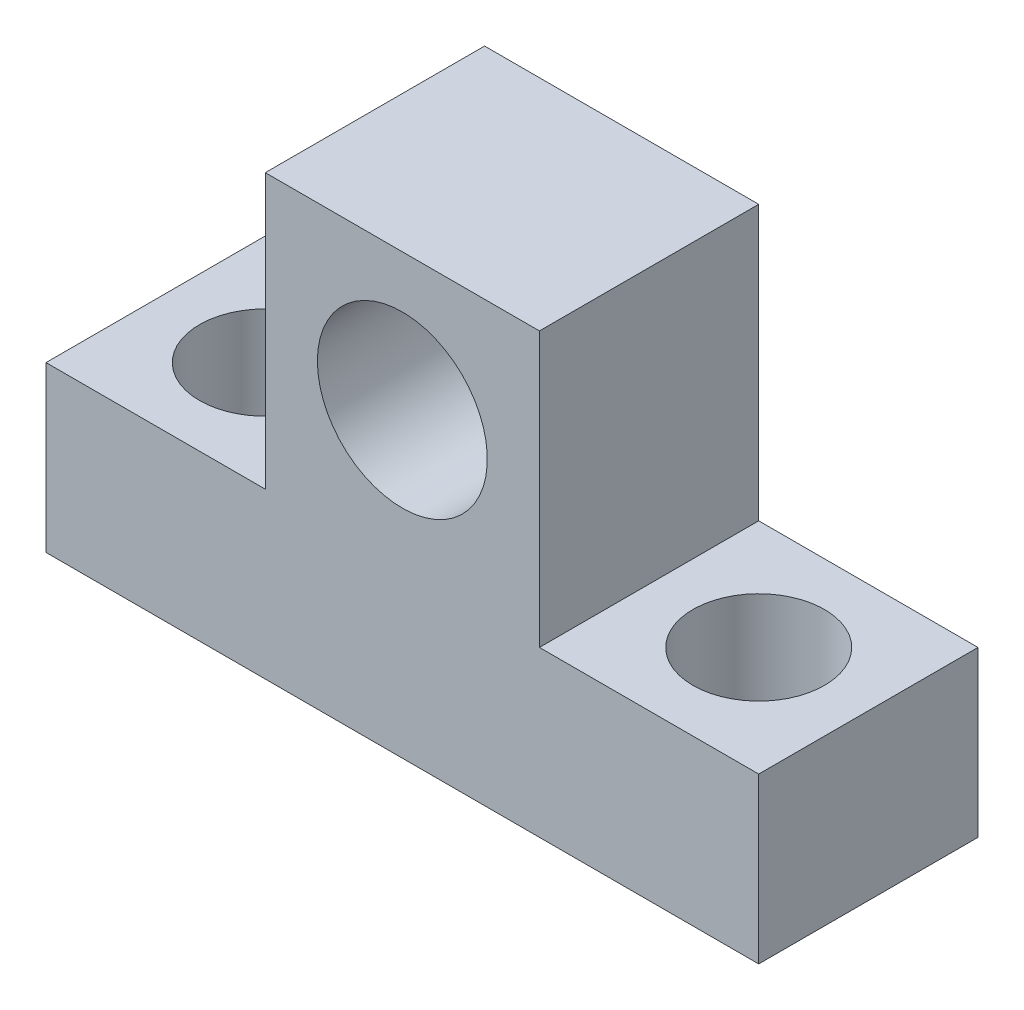
from build123d import *

# Parameters (mm, degrees)
SKETCH1_W              = 5
SKETCH1_H              = 5
BOSS_EXTRUDE1_DEPTH    = 2
M2_5_CLEARANCE_HOLE1_D = 3.1
BOSS_EXTRUDE3_DEPTH    = 3
M2_CLEARANCE_HOLE2_D   = 2.4


with BuildPart() as part:
    # Sketch1 → Boss-Extrude1 (new, symmetric)
    with BuildSketch(Plane.XY):
        Rectangle(SKETCH1_W, SKETCH1_H)
    extrude(amount=BOSS_EXTRUDE1_DEPTH, both=True)

    # M2.5 Clearance Hole1 (through all)
    with Locations(Plane(origin=(0, 0, -2), x_dir=(-1, 0, 0), z_dir=(0, 0, -1))):
        with Locations((0, 0)):
            Hole(M2_5_CLEARANCE_HOLE1_D / 2)

    # Sketch9 → Boss-Extrude3 (add)
    with BuildSketch(Plane.XZ.offset(2.5)):
        Polygon((-2.5, -2), (-6.5, -2), (-6.5, 2), (-2.5, 2), (2.5, 2), (6.5, 2), (6.5, -2), (2.5, -2), align=None)
    extrude(amount=BOSS_EXTRUDE3_DEPTH)

    # M2 Clearance Hole2 (through all)
    with Locations(Plane(origin=(0, -2.5, 0), x_dir=(1, 0, 0), z_dir=(0, 1, 0))):
        with Locations((-4.5, 0), (4.5, 0)):
            Hole(M2_CLEARANCE_HOLE2_D / 2)


solid = part.part
